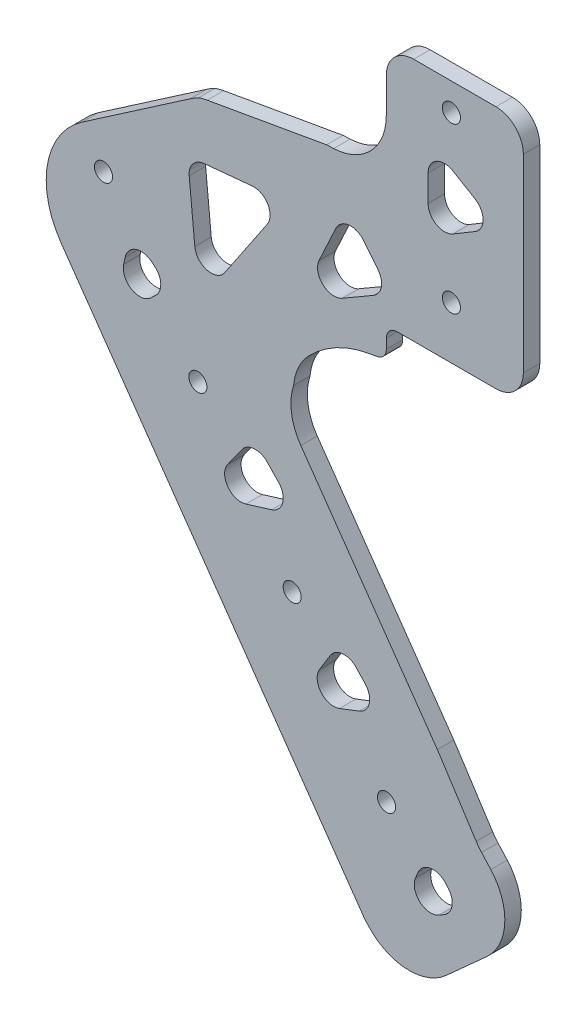
from build123d import *

# Parameters (mm, degrees)
SKETCH_1_R          = 1.65
EXTRUDE_1_DEPTH     = 3
CUT_EXTRUDE_1_DEPTH = 3
FILLET_1_R          = 10
EXTRUDE_2_DEPTH     = 3
FILLET_2_R          = 10
SKETCH_6_R          = 1.65
CUT_EXTRUDE_2_DEPTH = 33
FILLET_3_R          = 10
FILLET_4_R          = 10
EXTRUDE_3_DEPTH     = 3
SKETCH_8_R          = 1.65
CUT_EXTRUDE_3_DEPTH = 4
CUT_EXTRUDE_5_DEPTH = 4
FILLET_6_R          = 15
FILLET_7_R          = 15
CUT_EXTRUDE_6_DEPTH = 4
FILLET_8_R          = 3
CUT_EXTRUDE_7_DEPTH = 4
FILLET_11_R         = 2
FILLET_12_R         = 10
CUT_EXTRUDE_8_DEPTH = 4
FILLET_13_R         = 10


with BuildPart() as part:
    # 草图1 → 凸台-拉伸1 (new body)
    with BuildSketch(Plane.XY):
        with BuildLine():
            Line((0, -30), (-76.636599455, -43.513100194))
            Line((-76.636599455, -43.513100194), (-94.295597777, -47.000187555))
            Line((-94.295597777, -47.000187555), (6.073993177, -158.471911377))
            Line((6.073993177, -158.471911377), (28.368337941, -138.397993186))
            Line((28.368337941, -138.397993186), (-11.934165547, -93.637528433))
            ThreePointArc((-11.934165547, -93.637528433), (-15.981640549, -73.743553217), (-0.54423259, -60.558761246))
            Line((-0.54423259, -60.558761246), (29, -55.349315916))
            Line((29, -55.349315916), (29, -50))
            Line((29, -50), (29, 0))
            Line((29, 0), (0, 0))
            Line((0, 0), (0, -30))
        make_face()
        with Locations((14.5, -15)):
            Circle(SKETCH_1_R, mode=Mode.SUBTRACT)
        with Locations((14.5, -45)):
            Circle(SKETCH_1_R, mode=Mode.SUBTRACT)
    extrude(amount=EXTRUDE_1_DEPTH)

    # 草图2 → 切除-拉伸1 (cut)
    with BuildSketch(Plane.XY.offset(3)):
        Polygon((-37.509702142, -36.613972526), (-44.1108023, -102.736049466), (-92.232515274, -102.736049466), (-120.974922517, -15.648301308), align=None)
    extrude(amount=-CUT_EXTRUDE_1_DEPTH, mode=Mode.SUBTRACT)

    # 圆角1
    fillet_1_edges = [part.edges().sort_by_distance(p)[0] for p in [
        (0, 0, 1.5),
        (29, 0, 1.5),
        (29, -55.349315916, 1.5),
        (28.368337941, -138.397993186, 1.5),
        (6.073993177, -158.471911377, 1.5),
        (0, -30, 1.5),
        (-37.509702142, -36.613972526, 1.5),
        (-44.1108023, -102.736049466, 1.5),
    ]]
    fillet(fillet_1_edges, radius=FILLET_1_R)

    # 草图3 → 凸台-拉伸2 (add)
    with BuildSketch(Plane.XY.offset(3)):
        Polygon((-15.981640549, -73.743553217), (19.461958696, -128.506456934), (-25.512326967, -91.299735006), align=None)
    extrude(amount=-EXTRUDE_2_DEPTH)

    # 圆角2
    fillet_2_edges = [part.edges().sort_by_distance(p)[0] for p in [
        (-15.981640549, -73.743553217, 1.5),
        (19.461958696, -128.506456934, 1.5),
    ]]
    fillet(fillet_2_edges, radius=FILLET_2_R)

    # 草图6 → 切除-拉伸2 (cut)
    with BuildSketch(Plane.XY):
        Polygon((-87.672076615, -95.352784266), (10.45531874, -167.066930238), (-55.522232913, -72.841221354), align=None)
        Polygon((-17.568683959, -74.741102773), (35.029880069, -149.859637147), (-14.273329758, -72.43367092), align=None)
        with Locations((-31.747162049, -80.643839485)):
            Circle(SKETCH_6_R)
        with Locations((-14.539868958, -105.218400814)):
            Circle(SKETCH_6_R)
        with Locations(Location((2.667424132, -129.792962143, 0), (0, 0, 180))):
            Circle(SKETCH_6_R)
    extrude(amount=CUT_EXTRUDE_2_DEPTH, mode=Mode.SUBTRACT)

    # 圆角3
    # the kernel refuses this fillet: 10 mm, written as the material it adds along each edge
    with BuildSketch(Plane(origin=(-17.568683959, -74.741102773, 0), x_dir=(0.8191520442890025, 0.5735764363510307, 0), z_dir=(0, 0, 1))) as fillet_3_piece_1:
        with BuildLine():
            CenterArc((10, -8.017112469), FILLET_3_R, 126.706173487, 53.293826513)
            Line((0, -8.017112469), (-0.2, -8.017112469))
            Line((-0.2, -8.017112469), (-0.2, 0))
            Line((-0.2, 0), (0, 0.2))
            ThreePointArc((0, 0.2), (2.011442335, 0.2), (3.903342364, 0.160342249))
            Line((3.903342364, 0.160342249), (4.02288467, 0))
        make_face()
    extrude(amount=3)

    # 圆角4
    fillet_4_edges = [part.edges().sort_by_distance(p)[0] for p in [
        (-42.922716134, -90.835196128, 1.5),
    ]]
    fillet(fillet_4_edges, radius=FILLET_4_R)

    # 草图7 → 凸台-拉伸3 (add)
    with BuildSketch(Plane.XY.offset(3)):
        Polygon((-34.566125117, -102.769644932), (-65.373370144, -58.772339354), (-42.090796033, -16.519494834), (-31.58573936, -35.55781759), align=None)
    extrude(amount=-EXTRUDE_3_DEPTH)

    # 草图8 → 切除-拉伸3 (cut)
    with BuildSketch(Plane.XY.offset(3)):
        with Locations((-48.954455139, -56.069278157)):
            Circle(SKETCH_8_R)
    extrude(amount=-CUT_EXTRUDE_3_DEPTH, mode=Mode.SUBTRACT)

    # 草图9 → 切除-拉伸5 (cut)
    with BuildSketch(Plane.XY.offset(3)):
        Polygon((-31.58573936, -35.55781759), (-42.090796033, -16.519494834), (-65.373370144, -58.772339354), align=None)
    extrude(amount=-CUT_EXTRUDE_5_DEPTH, mode=Mode.SUBTRACT)

    # 圆角6
    fillet_6_edges = [part.edges().sort_by_distance(p)[0] for p in [
        (-65.373370144, -58.772339354, 1.5),
    ]]
    fillet(fillet_6_edges, radius=FILLET_6_R)

    # 圆角7
    # the kernel refuses this fillet: 15 mm, written as the material it takes off along each edge
    with BuildSketch(Plane(origin=(-31.58573936, -35.55781759, 7.815831315), x_dir=(-0.8242067246408917, -0.5662890384394996, 0), z_dir=(0, 0, -1))) as fillet_7_piece_1:
        with BuildLine():
            CenterArc((1.926332526, -15), FILLET_7_R, 90, 7.049103332)
            Line((0.085533646, -0.11337985), (0, 0))
            Line((0, 0), (1.926332526, 0))
        make_face()
    extrude(amount=12.63166263, mode=Mode.SUBTRACT)

    # 草图10 → 切除-拉伸6 (cut)
    with BuildSketch(Plane.XY.offset(3)):
        Polygon((-31.497161439, -67.881768792), (-15.547904948, -44.140451067), (-33.616807091, -45.881308748), align=None)
        Polygon((-13.635910341, -59.04618523), (3.278405873, -49.224969364), (-4.542191946, -39.403753498), align=None)
        Polygon((10.242872605, -36.716551154), (23.145942056, -29.046782931), (10.242872605, -21.377014708), align=None)
        Polygon((-47.382252639, -78.462252302), (-36.982602957, -68.475134443), (-43.961583104, -62.806110969), align=None)
        Polygon((-31.497161439, -98.196884234), (-13.635910341, -92.671187293), (-21.595666913, -84.382641882), align=None)
        Polygon((-14.194825195, -122.494735697), (1.82276298, -116.352745612), (-5.544832941, -108.458892839), align=None)
        Polygon((4.547829517, -147.416387444), (16.294826397, -140.502022472), (10.242872605, -133.5876575), align=None)
    extrude(amount=-CUT_EXTRUDE_6_DEPTH, mode=Mode.SUBTRACT)

    # 圆角8
    fillet_8_edges = [part.edges().sort_by_distance(p)[0] for p in [
        (16.294826397, -140.502022472, 1.5),
        (4.547829517, -147.416387444, 1.5),
        (10.242872605, -133.5876575, 1.5),
        (1.82276298, -116.352745612, 1.5),
        (-14.194825195, -122.494735697, 1.5),
        (-5.544832941, -108.458892839, 1.5),
        (-13.635910341, -92.671187293, 1.5),
        (-31.497161439, -98.196884234, 1.5),
        (-21.595666913, -84.382641882, 1.5),
        (-36.982602957, -68.475134443, 1.5),
        (-47.382252639, -78.462252302, 1.5),
        (-43.961583104, -62.806110969, 1.5),
        (23.145942056, -29.046782931, 1.5),
        (10.242872605, -36.716551154, 1.5),
        (10.242872605, -21.377014708, 1.5),
        (3.278405873, -49.224969364, 1.5),
        (-13.635910341, -59.04618523, 1.5),
        (-4.542191946, -39.403753498, 1.5),
        (-15.547904948, -44.140451067, 1.5),
        (-31.497161439, -67.881768792, 1.5),
        (-33.616807091, -45.881308748, 1.5),
    ]]
    fillet(fillet_8_edges, radius=FILLET_8_R)

    # 草图13 → 切除-拉伸7 (cut)
    with BuildSketch(Plane.XY.offset(3)):
        with BuildLine():
            ThreePointArc((2.619259417, -15), (4.083725511, -11.464466094), (7.619259417, -10))
            Line((7.619259417, -10), (22.619259417, -10))
            ThreePointArc((22.619259417, -10), (26.154793323, -11.464466094), (27.619259417, -15))
            Line((27.619259417, -15), (27.619259417, -49.552905051))
            ThreePointArc((27.619259417, -49.552905051), (26.154793323, -53.088438957), (22.619259417, -54.552905051))
            Line((22.619259417, -54.552905051), (2.619259417, -54.552905051))
            Line((2.619259417, -54.552905051), (2.619259417, -60.000952252))
            Line((2.619259417, -60.000952252), (20.736481777, -56.806397134))
            ThreePointArc((20.736481777, -56.806397134), (26.660444431, -53.386195701), (29, -46.958319604))
            Line((29, -46.958319604), (29, -10))
            ThreePointArc((29, -10), (26.071067812, -2.928932188), (19, 0))
            Line((19, 0), (10, 0))
            ThreePointArc((10, 0), (2.928932188, -2.928932188), (0, -10))
            Line((0, -10), (0, -15))
            Line((0, -15), (2.619259417, -15))
        make_face()
    extrude(amount=-CUT_EXTRUDE_7_DEPTH, mode=Mode.SUBTRACT)

    # 圆角11
    fillet_11_edges = [part.edges().sort_by_distance(p)[0] for p in [
        (2.619259417, -60.000952252, 1.5),
        (2.619259417, -54.552905051, 1.5),
    ]]
    fillet(fillet_11_edges, radius=FILLET_11_R)

    # 圆角12
    # the kernel refuses this fillet: 10 mm, written as the material it takes off along each edge
    with BuildSketch(Plane(origin=(0, -15, 19.695908746), x_dir=(1, 0, 0), z_dir=(0, 0, -1))) as fillet_12_piece_1:
        with BuildLine():
            CenterArc((9.999518916, 6.7477233), FILLET_12_R, 180.397405601, 42.039067217)
            Line((-0.000240542, 6.678363494), (-1.000216488, 6.671427514))
            ThreePointArc((-1.000216488, 6.671427514), (-1, 6.609003688), (-1, 0))
            Line((-1, 0), (0, -1))
            ThreePointArc((0, -1), (1.309629709, -1), (1.881233468, -0.67477233))
            Line((1.881233468, -0.67477233), (2.619259417, 0))
        make_face()
    extrude(amount=36.391817492, mode=Mode.SUBTRACT)

    # 草图14 → 切除-拉伸8 (cut)
    with BuildSketch(Plane.XY.offset(3)):
        Polygon((2.619259417, -15), (2.619259417, -31.018717886), (-8.263518223, -31.457081218), (-8.263518223, -7.080960467), align=None)
    extrude(amount=-CUT_EXTRUDE_8_DEPTH, mode=Mode.SUBTRACT)

    # 圆角13
    fillet_13_edges = [part.edges().sort_by_distance(p)[0] for p in [
        (2.619259417, -31.018717886, 1.5),
    ]]
    fillet(fillet_13_edges, radius=FILLET_13_R)


solid = part.part
